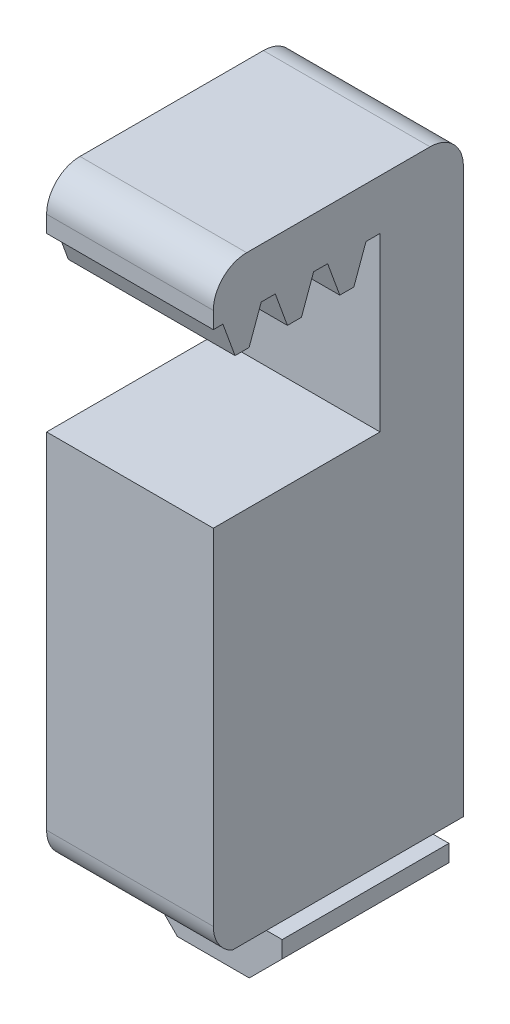
from build123d import *

# Parameters (mm, degrees)
BOSS_EXTRUDE1_DEPTH = 6.35
CUT_EXTRUDE1_DEPTH  = 52.132288234
LPATTERN1_COUNT     = 10
LPATTERN1_PITCH     = 3.989832
CUT_EXTRUDE2_DEPTH  = 50.935392258
FILLET1_R           = 2.54
CUT_EXTRUDE3_DEPTH  = 50.935392258
SKETCH6_W           = 12.7
SKETCH6_H           = 0.396875
CUT_EXTRUDE4_DEPTH  = 52.132288234


with BuildPart() as part:
    # Sketch1 → Boss-Extrude1 (new, symmetric)
    with BuildSketch(Plane(origin=(0, 0, 0), x_dir=(0, 0, -1), z_dir=(1, 0, 0))):
        Polygon((6.35, 0), (6.35, -6.096), (19.05, -6.096), (19.05, 45.72), (12.7, 45.72), (0, 45.72), (0, 39.37), (12.7, 39.37), (12.7, 29.21), (0, 29.21), (0, 0), align=None)
    extrude(amount=BOSS_EXTRUDE1_DEPTH, both=True)

    # Sketch2 → Cut-Extrude1 (cut, through all)
    with BuildSketch(Plane(origin=(6.35, 0, 0), x_dir=(0, 0, -1), z_dir=(1, 0, 0))):
        with BuildLine():
            Line((3.649904395, 41.91), (4.720336, 41.91))
            Line((4.720336, 41.91), (5.694793618, 39.232699698))
            ThreePointArc((5.694793618, 39.232699698), (5.787994572, 39.11123785), (5.934007978, 39.0652))
            Line((5.934007978, 39.0652), (6.426064417, 39.0652))
            ThreePointArc((6.426064417, 39.0652), (6.572077823, 39.11123785), (6.665278777, 39.232699698))
            Line((6.665278777, 39.232699698), (7.639736395, 41.91))
            Line((7.639736395, 41.91), (8.710168, 41.91))
            Line((8.710168, 41.91), (9.684625618, 39.232699698))
            ThreePointArc((9.684625618, 39.232699698), (9.777826572, 39.11123785), (9.923839978, 39.0652))
            Line((9.923839978, 39.0652), (10.415896417, 39.0652))
            ThreePointArc((10.415896417, 39.0652), (10.561909823, 39.11123785), (10.655110777, 39.232699698))
            Line((10.655110777, 39.232699698), (11.629568395, 41.91))
            Line((11.629568395, 41.91), (12.7, 41.91))
            Line((12.7, 41.91), (12.7, 29.21))
            Line((12.7, 29.21), (3.649904395, 29.21))
            Line((3.649904395, 29.21), (3.649904395, 41.91))
        make_face()
    cut_extrude1 = extrude(amount=-CUT_EXTRUDE1_DEPTH, mode=Mode.SUBTRACT)

    # LPattern1: Cut-Extrude1 ×10
    with Locations(*[(0, 0, i * LPATTERN1_PITCH) for i in range(1, LPATTERN1_COUNT)]):
        add(cut_extrude1, mode=Mode.SUBTRACT)

    # Sketch3 → Cut-Extrude2 (cut, through all)
    with BuildSketch(Plane(origin=(0, 0, -19.05), x_dir=(-1, 0, 0), z_dir=(0, 0, -1))):
        Polygon((-6.35, -6.096), (-2.839339828, -6.1), (-5.5, -3.439339828), (-5.5, -1.8), (-3.125, -1.8), (-3.125, -1.455), (-4.58, 0), (-9.5, 0), align=None)
        Polygon((2.839339828, -6.1), (6.35, -6.096), (15.42, 0), (4.58, 0), (3.125, -1.455), (3.125, -1.8), (5.5, -1.8), (5.5, -3.439339828), align=None)
    extrude(amount=-CUT_EXTRUDE2_DEPTH, mode=Mode.SUBTRACT)

    # Fillet1
    fillet1_edges = [part.edges().sort_by_distance(p)[0] for p in [
        (0, 0, 0),
        (0, 45.72, 0),
        (0, 45.72, -19.05),
    ]]
    fillet(fillet1_edges, radius=FILLET1_R)

    # Sketch5 → Cut-Extrude3 (cut, through all)
    with BuildSketch(Plane(origin=(0, 0, -19.05), x_dir=(-1, 0, 0), z_dir=(0, 0, -1))):
        Polygon((6.35, 0), (4.58, 0), (3.125, -1.455), (3.125, -1.8), (5.5, -1.8), (5.5, -3.439339828), (2.843339828, -6.096), (-2.843339828, -6.096), (-5.5, -3.439339828), (-5.5, -1.8), (-3.125, -1.8), (-3.125, -1.455), (-4.58, 0), (-6.35, 0), (-6.35, 0.254), (-4.474789755, 0.254), (-2.871, -1.349789755), (-2.871, -2.054), (-5.246, -2.054), (-5.246, -3.334129583), (-2.738129583, -5.842), (2.738129583, -5.842), (5.246, -3.334129583), (5.246, -2.054), (2.871, -2.054), (2.871, -1.349789755), (4.474789755, 0.254), (6.35, 0.254), align=None)
    extrude(amount=-CUT_EXTRUDE3_DEPTH, mode=Mode.SUBTRACT)

    # Sketch6 → Cut-Extrude4 (cut, through all)
    with BuildSketch(Plane(origin=(6.35, 0, 0), x_dir=(0, 0, -1), z_dir=(1, 0, 0))):
        with Locations((6.35, 29.0115625)):
            Rectangle(SKETCH6_W, SKETCH6_H)
    extrude(amount=-CUT_EXTRUDE4_DEPTH, mode=Mode.SUBTRACT)


solid = part.part
